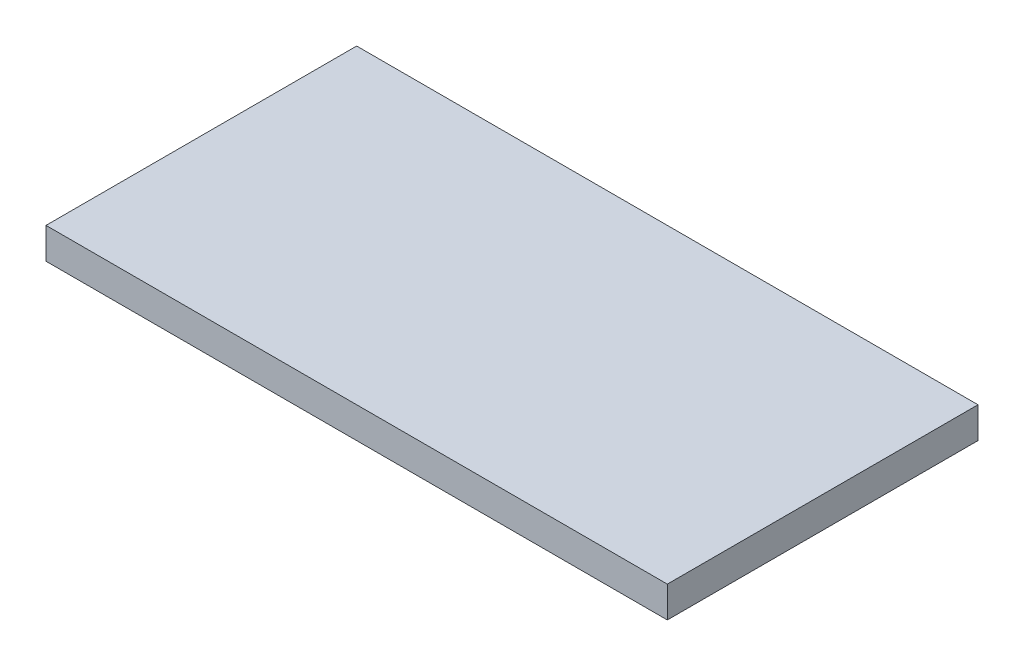
from build123d import *

# Parameters (mm, degrees)
SKETCH1_W           = 40
SKETCH1_H           = 20
BOSS_EXTRUDE1_DEPTH = 2


with BuildPart() as part:
    # Sketch1 → Boss-Extrude1 (new body)
    with BuildSketch(Plane(origin=(0, 0, 0), x_dir=(1, 0, 0), z_dir=(0, 1, 0))):
        Rectangle(SKETCH1_W, SKETCH1_H)
    extrude(amount=-BOSS_EXTRUDE1_DEPTH)


solid = part.part
